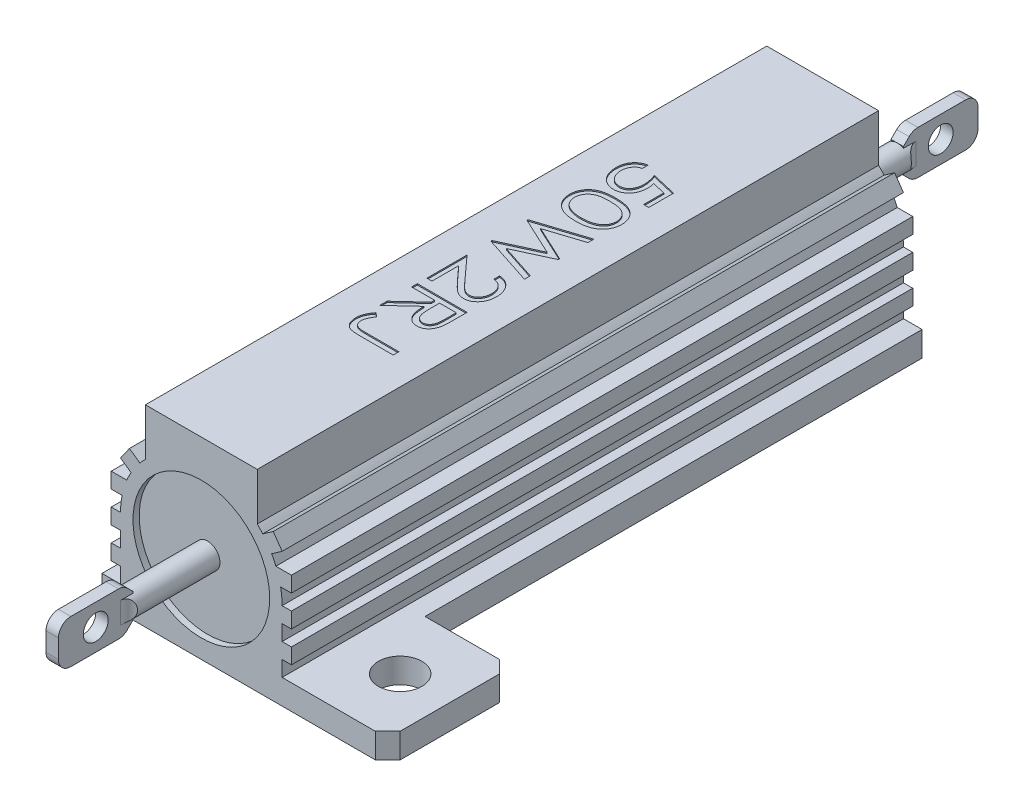
from build123d import *
from build123d.topology import SkipClean

# Parameters (mm, degrees)
BOSS_EXTRUDE1_DEPTH = 25
SKETCH3_W           = 7
SKETCH3_H           = 10
SKETCH3_R           = 1.75
BOSS_EXTRUDE5_DEPTH = 2
CHAMFER1_SIZE       = 1
BOSS_EXTRUDE2_DEPTH = 24.5
BOSS_EXTRUDE3_DEPTH = 31
SKETCH2_R           = 1
BOSS_EXTRUDE4_DEPTH = 0.5
FILLET1_R           = 1
CUT_EXTRUDE1_DEPTH  = 0.1


with BuildPart() as part:
    # Sketch1 → Boss-Extrude1 (new, symmetric)
    with BuildSketch(Plane.XY):
        with BuildLine():
            Line((-8, -7), (-6.5, -7))
            Line((-6.5, -7), (6.5, -7))
            Line((6.5, -7), (8, -7))
            Line((8, -7), (8, -5))
            Line((8, -5), (6.5, -5))
            Line((6.5, -5), (6.5, -3.75))
            Line((6.5, -3.75), (7.25, -3.75))
            Line((7.25, -3.75), (7.25, -2.5))
            Line((7.25, -2.5), (6.5, -2.5))
            Line((6.5, -2.5), (6.5, -1.25))
            Line((6.5, -1.25), (7.25, -1.25))
            Line((7.25, -1.25), (7.25, 0))
            Line((7.25, 0), (6.5, 0))
            ThreePointArc((6.5, 0), (6.469597753, 0.62793703), (6.378675411, 1.25))
            Line((6.378675411, 1.25), (7.25, 1.25))
            Line((7.25, 1.25), (7.25, 2.5))
            Line((7.25, 2.5), (6, 2.5))
            ThreePointArc((6, 2.5), (5.839619421, 2.854618191), (5.65830246, 3.199001918))
            Line((5.65830246, 3.199001918), (6.502125605, 3.789853245))
            Line((6.502125605, 3.789853245), (5.785155059, 4.8137933))
            Line((5.785155059, 4.8137933), (4.941331915, 4.222941973))
            ThreePointArc((4.941331915, 4.222941973), (4.726448986, 4.462138499), (4.5, 4.69041576))
            Line((4.5, 4.69041576), (4.5, 3.16227766))
            ThreePointArc((4.5, 3.16227766), (5.244044241, 1.658312395), (5.5, 0))
            ThreePointArc((5.5, 0), (-1.658312395, -5.244044241), (-4.5, 3.16227766))
            Line((-4.5, 3.16227766), (-4.5, 4.69041576))
            ThreePointArc((-4.5, 4.69041576), (-4.726448986, 4.462138499), (-4.941331915, 4.222941973))
            Line((-4.941331915, 4.222941973), (-5.785155059, 4.8137933))
            Line((-5.785155059, 4.8137933), (-6.502125605, 3.789853245))
            Line((-6.502125605, 3.789853245), (-5.65830246, 3.199001918))
            ThreePointArc((-5.65830246, 3.199001918), (-5.839619421, 2.854618191), (-6, 2.5))
            Line((-6, 2.5), (-7.25, 2.5))
            Line((-7.25, 2.5), (-7.25, 1.25))
            Line((-7.25, 1.25), (-6.378675411, 1.25))
            ThreePointArc((-6.378675411, 1.25), (-6.469597753, 0.62793703), (-6.5, 0))
            Line((-6.5, 0), (-7.25, 0))
            Line((-7.25, 0), (-7.25, -1.25))
            Line((-7.25, -1.25), (-6.5, -1.25))
            Line((-6.5, -1.25), (-6.5, -2.5))
            Line((-6.5, -2.5), (-7.25, -2.5))
            Line((-7.25, -2.5), (-7.25, -3.75))
            Line((-7.25, -3.75), (-6.5, -3.75))
            Line((-6.5, -3.75), (-6.5, -5))
            Line((-6.5, -5), (-8, -5))
            Line((-8, -5), (-8, -7))
        make_face()
        with BuildLine():
            ThreePointArc((4.5, 4.69041576), (0, 6.5), (-4.5, 4.69041576))
            Line((-4.5, 4.69041576), (-4.5, 3.16227766))
            ThreePointArc((-4.5, 3.16227766), (0, 5.5), (4.5, 3.16227766))
            Line((4.5, 3.16227766), (4.5, 4.69041576))
        make_face()
        with BuildLine():
            Line((-4.5, 8.5), (-4.5, 4.69041576))
            ThreePointArc((-4.5, 4.69041576), (0, 6.5), (4.5, 4.69041576))
            Line((4.5, 4.69041576), (4.5, 8.5))
            Line((4.5, 8.5), (-4.5, 8.5))
        make_face()
    extrude(amount=BOSS_EXTRUDE1_DEPTH, both=True)

    # Sketch3 → Boss-Extrude5 (add)
    # profile 1 of 2: a face of its own
    with BuildSketch(Plane.XZ.offset(7)):
        with Locations((11.5, 20)):
            Rectangle(SKETCH3_W, SKETCH3_H)
        with Locations((11, 20)):
            Circle(SKETCH3_R, mode=Mode.SUBTRACT)
    # profile 2 of 2: a face of its own
    with BuildSketch(Plane.XZ.offset(7)):
        with Locations((-11.5, -20)):
            Rectangle(SKETCH3_W, SKETCH3_H)
        with Locations((-11, -20)):
            Circle(SKETCH3_R, mode=Mode.SUBTRACT)
    extrude(amount=-BOSS_EXTRUDE5_DEPTH)

    # Chamfer1
    chamfer1_edges = [part.edges().sort_by_distance(p)[0] for p in [
        (15, -6, 25),
        (15, -6, 15),
        (-15, -6, -25),
        (-15, -6, -15),
    ]]
    chamfer(chamfer1_edges, length=CHAMFER1_SIZE)

    # Sketch4 → Cut-Extrude1 (cut)
    # profile 1 of 6: a face of its own
    with BuildSketch(Plane(origin=(0, 8.5, 0), x_dir=(1, 0, 0), z_dir=(0, 1, 0))):
        with BuildLine():
            Line((2, 9), (1.58974359, 9))
            Line((1.58974359, 9), (1.58974359, 10.623397436))
            Line((1.58974359, 10.623397436), (0.532852564, 10.867788462))
            add(Edge.make_bspline(
                [(0.532852564, 10.867788462), (0.545515776, 10.81824875), (0.570016319, 10.722400257), (0.595129408, 10.580728118), (0.612791333, 10.446761137), (0.614538174, 10.359560985), (0.615384615, 10.317307692)],
                knots=[0, 0, 0, 0, 1.098923107, 2.126175579, 3.092028514, 4, 4, 4, 4], degree=3))
            add(Edge.make_bspline(
                [(0.615384615, 10.317307692), (0.614420833, 10.265170431), (0.612527032, 10.162722458), (0.594273232, 10.01267072), (0.565747419, 9.869473083), (0.525595249, 9.733468535), (0.474196448, 9.604243292), (0.410621807, 9.482247605), (0.335824672, 9.366872644), (0.249722975, 9.260153573), (0.1545364, 9.16380246), (0.053572076, 9.077619795), (-0.055118695, 9.006245124), (-0.170276956, 8.947977256), (-0.2916679, 8.902153844), (-0.419764378, 8.869202991), (-0.55441913, 8.849706339), (-0.646303066, 8.847352764), (-0.693108974, 8.846153846)],
                knots=[0, 0, 0, 0, 1.134306129, 2.228873559, 3.284575577, 4.309103366, 5.310866403, 6.306691536, 7.298316829, 8.298797156, 9.285365892, 10.242552919, 11.182533008, 12.108057413, 13.046310257, 14.000845743, 14.981625785, 16, 16, 16, 16], degree=3))
            add(Edge.make_bspline(
                [(-0.693108974, 8.846153846), (-0.725724228, 8.846693175), (-0.79059043, 8.847765808), (-0.886691495, 8.858715416), (-0.980933942, 8.875477791), (-1.073045693, 8.898754757), (-1.16324176, 8.928217259), (-1.250786459, 8.965642039), (-1.336941637, 9.00885615), (-1.420403424, 9.059098671), (-1.500407698, 9.115110516), (-1.575985703, 9.176082872), (-1.646341157, 9.241992976), (-1.712809031, 9.311862544), (-1.773211814, 9.387360884), (-1.829994679, 9.467002825), (-1.880851662, 9.551945408), (-1.927325232, 9.641065031), (-1.969436936, 9.733845117), (-2.004226251, 9.83140196), (-2.034867896, 9.932123614), (-2.059595738, 10.036507322), (-2.078922283, 10.144042984), (-2.092120524, 10.255096344), (-2.101691768, 10.369758403), (-2.102270276, 10.447628742), (-2.102564103, 10.487179487)],
                knots=[0, 0, 0, 0, 0.969887702, 1.928941986, 2.873436412, 3.815789427, 4.753003305, 5.693042149, 6.645358263, 7.618300532, 8.588188234, 9.548656786, 10.504380954, 11.45430748, 12.414776032, 13.378165196, 14.362012553, 15.357121383, 16.367185624, 17.390198941, 18.435887273, 19.497781362, 20.57943811, 21.684223554, 22.823805247, 24, 24, 24, 24], degree=3))
            add(Edge.make_bspline(
                [(-2.102564103, 10.487179487), (-2.10177636, 10.533971364), (-2.10022801, 10.62594326), (-2.084005173, 10.760816417), (-2.060787507, 10.890477431), (-2.025897143, 11.014206383), (-1.981878402, 11.132907213), (-1.927188163, 11.245545106), (-1.863755968, 11.353225641), (-1.789882448, 11.453591916), (-1.709000315, 11.546954805), (-1.621038468, 11.630623771), (-1.527956704, 11.705182877), (-1.428071715, 11.768138856), (-1.323203052, 11.822637556), (-1.212207665, 11.866342548), (-1.095740075, 11.901656286), (-1.015143188, 11.91587956), (-0.974358974, 11.923076923)],
                knots=[0, 0, 0, 0, 1.123367549, 2.208038014, 3.258707693, 4.284481523, 5.291404347, 6.295687251, 7.288117666, 8.289013781, 9.284818446, 10.25134312, 11.201179919, 12.144429081, 13.082690711, 14.035750275, 15.006036297, 16, 16, 16, 16], degree=3))
            Line((-0.974358974, 11.923076923), (-0.974358974, 11.461538462))
            add(Edge.make_bspline(
                [(-0.974358974, 11.461538462), (-1.012616836, 11.451866417), (-1.086562385, 11.4331721), (-1.189009172, 11.389369079), (-1.281732796, 11.338724226), (-1.362645945, 11.275857021), (-1.434398904, 11.203242975), (-1.497741759, 11.11964673), (-1.555038822, 11.025685527), (-1.602651632, 10.921243055), (-1.643123962, 10.811134478), (-1.670595582, 10.69625493), (-1.689402155, 10.579145036), (-1.691335887, 10.499807362), (-1.692307692, 10.459935897)],
                knots=[0, 0, 0, 0, 1.060576442, 2.049903014, 2.989775767, 3.897109116, 4.796892185, 5.730087544, 6.713966125, 7.752830045, 8.814794405, 9.866194127, 10.92764736, 12, 12, 12, 12], degree=3))
            add(Edge.make_bspline(
                [(-1.692307692, 10.459935897), (-1.691364481, 10.42116312), (-1.689504679, 10.344711817), (-1.675352861, 10.232187956), (-1.653587975, 10.123611295), (-1.620469294, 10.019780508), (-1.581375769, 9.918930231), (-1.530031324, 9.823833102), (-1.471152432, 9.732208787), (-1.403888297, 9.646072318), (-1.32991369, 9.566851862), (-1.250214198, 9.497500498), (-1.166030903, 9.438572815), (-1.076752004, 9.391076491), (-0.983781206, 9.352981429), (-0.885845253, 9.326405626), (-0.783331339, 9.311195932), (-0.713458276, 9.308874296), (-0.677884615, 9.307692308)],
                knots=[0, 0, 0, 0, 1.088617922, 2.146512666, 3.18073907, 4.193857714, 5.203749857, 6.213781285, 7.222920953, 8.259782748, 9.278688868, 10.262388098, 11.221673824, 12.158013981, 13.096874736, 14.037681318, 15.0009475, 16, 16, 16, 16], degree=3))
            add(Edge.make_bspline(
                [(-0.677884615, 9.307692308), (-0.645776502, 9.308573356), (-0.582826322, 9.310300712), (-0.490889303, 9.325129203), (-0.403713261, 9.349070244), (-0.321167461, 9.383117242), (-0.243365846, 9.426655298), (-0.169492816, 9.479020725), (-0.101335445, 9.542158243), (-0.038331904, 9.61438622), (0.019295755, 9.694043508), (0.069011826, 9.780906051), (0.110683919, 9.874245344), (0.146443757, 9.97334394), (0.172205632, 10.079856241), (0.191582166, 10.191984956), (0.202764654, 10.310672005), (0.204325937, 10.391803837), (0.205128205, 10.43349359)],
                knots=[0, 0, 0, 0, 0.959607918, 1.881377768, 2.776607197, 3.65761547, 4.544289218, 5.437449904, 6.358839065, 7.315284292, 8.299439248, 9.294038853, 10.302048393, 11.352906328, 12.439604126, 13.574060817, 14.753426351, 16, 16, 16, 16], degree=3))
            add(Edge.make_bspline(
                [(0.205128205, 10.43349359), (0.204476532, 10.46983782), (0.203137533, 10.54451468), (0.192939112, 10.659234783), (0.176874851, 10.779538037), (0.15422388, 10.905417362), (0.125396906, 11.036666872), (0.089680806, 11.173381196), (0.0482573, 11.315890896), (0.016339103, 11.412224667), (0, 11.461538462)],
                knots=[0, 0, 0, 0, 0.828490731, 1.702308341, 2.623773087, 3.594863751, 4.617271015, 5.686547465, 6.815730754, 8, 8, 8, 8], degree=3))
            Line((0, 11.461538462), (2, 11))
            Line((2, 11), (2, 9))
        make_face()
    # profile 2 of 6: a face of its own
    with BuildSketch(Plane(origin=(0, 8.5, 0), x_dir=(1, 0, 0), z_dir=(0, 1, 0))):
        with BuildLine():
            add(Edge.make_bspline(
                [(-0.001602564, 8.333333333), (0.06251601, 8.332789412), (0.187089565, 8.331732647), (0.368521938, 8.321528977), (0.538971244, 8.307365626), (0.697953809, 8.28443674), (0.845758006, 8.2569777), (0.982302666, 8.222625826), (1.107772825, 8.182068749), (1.222488955, 8.134383286), (1.328042887, 8.080782463), (1.427076663, 8.023531002), (1.518840784, 7.959517086), (1.604572209, 7.891052971), (1.683272472, 7.816802878), (1.756062286, 7.738385441), (1.820670869, 7.653465747), (1.880250573, 7.565005657), (1.932042817, 7.471673557), (1.977863028, 7.375721784), (2.016448684, 7.276901495), (2.047662374, 7.175323605), (2.07267235, 7.071269482), (2.09014998, 6.964420598), (2.100962796, 6.854926878), (2.102025931, 6.781008224), (2.102564103, 6.743589744)],
                knots=[0, 0, 0, 0, 1.542683654, 2.997221792, 4.371598944, 5.656797318, 6.860561199, 7.987553175, 9.042377021, 10.030645594, 10.973394823, 11.889388256, 12.780791065, 13.663064894, 14.526958713, 15.382106205, 16.234399085, 17.091789701, 17.946381534, 18.800199673, 19.648776936, 20.49647757, 21.355408439, 22.221808829, 23.099858982, 24, 24, 24, 24], degree=3))
            add(Edge.make_bspline(
                [(2.102564103, 6.743589744), (2.102025692, 6.705637427), (2.100961929, 6.63065327), (2.090148894, 6.519561068), (2.072674729, 6.411112669), (2.047657949, 6.3054623), (2.016472527, 6.202272908), (1.977808464, 6.101900055), (1.932245014, 6.004049559), (1.879216391, 5.909687615), (1.819919768, 5.818427097), (1.752721936, 5.732284396), (1.678526787, 5.651134053), (1.598111283, 5.57426875), (1.509722035, 5.503423963), (1.414878916, 5.436513344), (1.312765413, 5.374876326), (1.203491065, 5.317775613), (1.086043141, 5.265970476), (0.958952145, 5.222111136), (0.822283535, 5.185544786), (0.676187356, 5.155300362), (0.520309893, 5.131083364), (0.354701788, 5.114991242), (0.179635059, 5.104028066), (0.059847118, 5.103060468), (-0.001602564, 5.102564103)],
                knots=[0, 0, 0, 0, 0.905226779, 1.788498657, 2.660108446, 3.524138063, 4.376813936, 5.230061085, 6.088148717, 6.949707488, 7.810441066, 8.682307051, 9.552891307, 10.431831136, 11.333484681, 12.252799274, 13.19921049, 14.17683564, 15.192654415, 16.258736151, 17.380986388, 18.565756088, 19.816677794, 21.14251623, 22.534147352, 24, 24, 24, 24], degree=3))
            add(Edge.make_bspline(
                [(-0.001602564, 5.102564103), (-0.062784547, 5.103065863), (-0.182037556, 5.104043872), (-0.356313237, 5.114929037), (-0.521047907, 5.131288021), (-0.676147942, 5.154552545), (-0.821616313, 5.183662183), (-0.95740195, 5.220916011), (-1.084231393, 5.263327595), (-1.201063042, 5.314604442), (-1.309547196, 5.370869181), (-1.411199933, 5.431866863), (-1.505755245, 5.498581103), (-1.594076608, 5.569766662), (-1.675602628, 5.646053776), (-1.749243399, 5.728273925), (-1.816869268, 5.814741836), (-1.876970427, 5.906240145), (-1.929623939, 6.001892392), (-1.976284546, 6.099872843), (-2.014764304, 6.201060902), (-2.046941609, 6.304278279), (-2.071995892, 6.410571262), (-2.089005528, 6.519355612), (-2.101248131, 6.630599162), (-2.102121972, 6.705627987), (-2.102564103, 6.743589744)],
                knots=[0, 0, 0, 0, 1.460743023, 2.84721075, 4.167850277, 5.412587228, 6.590844802, 7.707910044, 8.772833715, 9.781134206, 10.751002957, 11.689474493, 12.609583831, 13.512016852, 14.396351346, 15.272413723, 16.145033432, 17.015342675, 17.883218137, 18.750530986, 19.604515764, 20.465899004, 21.330675571, 22.209334244, 23.093990656, 24, 24, 24, 24], degree=3))
            add(Edge.make_bspline(
                [(-2.102564103, 6.743589744), (-2.102022963, 6.781007683), (-2.100953965, 6.854925266), (-2.090184105, 6.964426825), (-2.072598993, 7.070929408), (-2.04829964, 7.174708247), (-2.018438234, 7.276056825), (-1.979238739, 7.373911409), (-1.93452956, 7.469291544), (-1.883427019, 7.56177066), (-1.824533093, 7.649817798), (-1.759969592, 7.734276692), (-1.687587677, 7.813155042), (-1.607514912, 7.885608905), (-1.522806105, 7.955349548), (-1.429971063, 8.018538525), (-1.330509243, 8.076843634), (-1.224097407, 8.131176266), (-1.10858473, 8.179610955), (-0.982456034, 8.221294078), (-0.845077561, 8.254943864), (-0.697532539, 8.283954326), (-0.538907217, 8.306214764), (-0.369382326, 8.321864099), (-0.188950241, 8.33162685), (-0.065183789, 8.332754194), (-0.001602564, 8.333333333)],
                knots=[0, 0, 0, 0, 0.901313614, 1.780507586, 2.648036619, 3.500347198, 4.347271604, 5.190962528, 6.037324413, 6.884273269, 7.733858471, 8.587261616, 9.443523092, 10.308877354, 11.187293768, 12.085154678, 13.011148997, 13.963773228, 14.961747202, 16.026069565, 17.160769593, 18.367320705, 19.647821669, 21.018168876, 22.468175576, 24, 24, 24, 24], degree=3))
        make_face()
        with BuildLine():
            add(Edge.make_bspline(
                [(0, 7.871794872), (-0.053424022, 7.871280344), (-0.157106416, 7.870281778), (-0.307859368, 7.864115192), (-0.448420859, 7.852873236), (-0.578949196, 7.837984738), (-0.699348417, 7.818144395), (-0.809811537, 7.793416133), (-0.910270116, 7.764840456), (-1.001393714, 7.731760447), (-1.084411094, 7.693661598), (-1.161729501, 7.651825967), (-1.233940124, 7.606311802), (-1.301049949, 7.55635306), (-1.362671531, 7.501663171), (-1.419779757, 7.443289993), (-1.471496168, 7.380254766), (-1.532099612, 7.291642542), (-1.596661344, 7.176259264), (-1.651081099, 7.030859934), (-1.685854705, 6.881437319), (-1.690149134, 6.78010201), (-1.692307692, 6.729166667)],
                knots=[0, 0, 0, 0, 1.388587631, 2.694894295, 3.920573386, 5.05291137, 6.108598713, 7.090490714, 7.993531689, 8.82151309, 9.607480571, 10.365416635, 11.104976342, 11.824185169, 12.537337675, 13.244279737, 13.944715534, 14.653359842, 16.032946572, 17.368730189, 18.677414287, 20, 20, 20, 20], degree=3))
            add(Edge.make_bspline(
                [(-1.692307692, 6.729166667), (-1.690524086, 6.677951008), (-1.686984163, 6.576303354), (-1.651750866, 6.427424759), (-1.599145666, 6.282940414), (-1.536163762, 6.168897504), (-1.47629641, 6.082066083), (-1.425085367, 6.020404337), (-1.368566602, 5.962970894), (-1.306076117, 5.910154409), (-1.239727397, 5.859620678), (-1.166396232, 5.815486401), (-1.08850997, 5.773976225), (-1.033581169, 5.750657159), (-1.005608974, 5.738782051)],
                knots=[0, 0, 0, 0, 1.435202654, 2.84844493, 4.271653763, 5.741104123, 6.489771913, 7.229832304, 7.987899838, 8.748188279, 9.524858768, 10.325895147, 11.147471145, 12, 12, 12, 12], degree=3))
            add(Edge.make_bspline(
                [(-1.005608974, 5.738782051), (-0.969985247, 5.724691486), (-0.89789939, 5.696178735), (-0.784966465, 5.661516441), (-0.667525691, 5.630567624), (-0.5442493, 5.607156933), (-0.416008133, 5.58753606), (-0.281983718, 5.574538474), (-0.142766542, 5.564969997), (-0.04809445, 5.56439478), (0, 5.564102564)],
                knots=[0, 0, 0, 0, 0.89477914, 1.810616812, 2.758161515, 3.731176502, 4.7408655, 5.788454827, 6.876511068, 8, 8, 8, 8], degree=3))
            add(Edge.make_bspline(
                [(0, 5.564102564), (0.048087242, 5.564537191), (0.142180988, 5.56538764), (0.279824719, 5.57280183), (0.41090857, 5.584302816), (0.535101894, 5.60238879), (0.652867463, 5.623569229), (0.764062787, 5.649758718), (0.86813572, 5.682210441), (0.966351124, 5.717849029), (1.057378031, 5.758836457), (1.142293867, 5.803100246), (1.220921163, 5.851026302), (1.293359248, 5.903151481), (1.359060691, 5.959393187), (1.418920617, 6.018808765), (1.471822685, 6.082264572), (1.533331525, 6.170553792), (1.595680111, 6.286211532), (1.652627214, 6.429703711), (1.685422657, 6.578391693), (1.690007801, 6.67880148), (1.692307692, 6.729166667)],
                knots=[0, 0, 0, 0, 1.249780456, 2.445482825, 3.581852642, 4.668687876, 5.706271375, 6.691314309, 7.63556384, 8.538297997, 9.405302693, 10.228187559, 11.02591342, 11.796629424, 12.545106863, 13.271626958, 13.986275284, 14.689228451, 16.065495506, 17.390812878, 18.691241169, 20, 20, 20, 20], degree=3))
            add(Edge.make_bspline(
                [(1.692307692, 6.729166667), (1.690025216, 6.780335438), (1.685486931, 6.882075169), (1.652679074, 7.032327461), (1.596227565, 7.176693848), (1.532789251, 7.291513629), (1.473179351, 7.379740208), (1.421037584, 7.441652383), (1.364622786, 7.500185725), (1.302093585, 7.55379911), (1.23586617, 7.604865218), (1.163274583, 7.650141482), (1.086051044, 7.692139774), (1.002816753, 7.729944037), (0.912071301, 7.76431504), (0.811618056, 7.79238289), (0.701277169, 7.817637397), (0.580474889, 7.836881377), (0.449819179, 7.853097061), (0.308921073, 7.864095109), (0.15790953, 7.870292419), (0.053691811, 7.871284013), (0, 7.871794872)],
                knots=[0, 0, 0, 0, 1.329473786, 2.643415121, 3.97515249, 5.345273436, 6.044244214, 6.739308648, 7.44623188, 8.154789303, 8.878154807, 9.617694816, 10.37561069, 11.161557236, 11.991928558, 12.894945479, 13.870039332, 14.932546687, 16.072574108, 17.291300563, 18.604508161, 20, 20, 20, 20], degree=3))
        make_face(mode=Mode.SUBTRACT)
    # profile 3 of 6: a face of its own
    with BuildSketch(Plane(origin=(0, 8.5, 0), x_dir=(1, 0, 0), z_dir=(0, 1, 0))):
        Polygon((2, 4.58974359), (2, 4.110576923), (-0.871794872, 3.179487179), (2, 1.838942308), (2, 1.737179487), (-0.871794872, 0.41025641), (2, -0.525641026), (2, -1), (-2, 0.303685897), (-2, 0.396634615), (1.025641026, 1.794871795), (-2, 3.207532051), (-2, 3.292467949), align=None)
    # profile 4 of 6: a face of its own
    with BuildSketch(Plane(origin=(0, 8.5, 0), x_dir=(1, 0, 0), z_dir=(0, 1, 0))):
        with BuildLine():
            Line((0.769230769, -2.230769231), (0.769230769, -1.769230769))
            add(Edge.make_bspline(
                [(0.769230769, -1.769230769), (0.816876526, -1.771964035), (0.910634632, -1.7773426), (1.047455059, -1.802568524), (1.177448513, -1.841628166), (1.30179788, -1.892261806), (1.418107785, -1.959518216), (1.529959001, -2.036794479), (1.633138534, -2.130185272), (1.729821135, -2.234678377), (1.816967213, -2.349164586), (1.894076891, -2.470840859), (1.957922643, -2.59974868), (2.011458971, -2.734921675), (2.051761814, -2.877071171), (2.081723565, -3.025411938), (2.099626583, -3.18038089), (2.101573649, -3.286010701), (2.102564103, -3.33974359)],
                knots=[0, 0, 0, 0, 0.999305455, 1.966449753, 2.906727325, 3.840100279, 4.772415491, 5.71648318, 6.683708445, 7.681790664, 8.695968757, 9.694427516, 10.695611955, 11.705828884, 12.736763285, 13.787187205, 14.874362987, 16, 16, 16, 16], degree=3))
            add(Edge.make_bspline(
                [(2.102564103, -3.33974359), (2.101519222, -3.392671492), (2.099471444, -3.496400652), (2.082523164, -3.647860481), (2.054239768, -3.79139616), (2.016216219, -3.927690821), (1.965584843, -4.056230472), (1.903507332, -4.17677802), (1.831379403, -4.290175986), (1.747024232, -4.393189685), (1.656689852, -4.487311042), (1.561010207, -4.569606653), (1.461246786, -4.63913389), (1.357126412, -4.695585276), (1.249132714, -4.739898331), (1.137264364, -4.772471615), (1.020919623, -4.79102026), (0.942104075, -4.793578155), (0.90224359, -4.794871795)],
                knots=[0, 0, 0, 0, 1.208765672, 2.368963135, 3.475747546, 4.54760944, 5.596726645, 6.625421298, 7.640840976, 8.660376309, 9.661397379, 10.617631144, 11.538305991, 12.433750383, 13.317478723, 14.199942547, 15.089631881, 16, 16, 16, 16], degree=3))
            add(Edge.make_bspline(
                [(0.90224359, -4.794871795), (0.874179866, -4.794178614), (0.818184905, -4.792795526), (0.73481578, -4.784029248), (0.652723811, -4.768415105), (0.571692811, -4.747877845), (0.492112039, -4.720513614), (0.414194726, -4.686421842), (0.337337713, -4.647211669), (0.260043817, -4.601585238), (0.181622122, -4.545242749), (0.096256143, -4.480579277), (0.005080335, -4.40324488), (-0.092082071, -4.31411245), (-0.196797667, -4.214721808), (-0.306924236, -4.102841404), (-0.424842893, -3.980595955), (-0.504451227, -3.894131158), (-0.545673077, -3.849358974)],
                knots=[0, 0, 0, 0, 0.755037436, 1.506510444, 2.252051041, 3.001459937, 3.753619725, 4.513157152, 5.287639056, 6.073865477, 6.925081015, 7.88368158, 8.954604251, 10.13979607, 11.43073035, 12.838176805, 14.362781941, 16, 16, 16, 16], degree=3))
            Line((-0.545673077, -3.849358974), (-1.58974359, -2.697916667))
            Line((-1.58974359, -2.697916667), (-1.58974359, -4.846153846))
            Line((-1.58974359, -4.846153846), (-2, -4.846153846))
            Line((-2, -4.846153846), (-2, -1.615384615))
            Line((-2, -1.615384615), (-0.344551282, -3.442307692))
            add(Edge.make_bspline(
                [(-0.344551282, -3.442307692), (-0.305116604, -3.486729579), (-0.229409798, -3.572010842), (-0.11920392, -3.693113224), (-0.016042842, -3.801271294), (0.077746014, -3.898758825), (0.165349022, -3.982400374), (0.243717963, -4.055351094), (0.314930277, -4.115407003), (0.397724292, -4.179162312), (0.499129053, -4.240571557), (0.623114393, -4.294435602), (0.751242653, -4.327387999), (0.837954269, -4.331348505), (0.881410256, -4.333333333)],
                knots=[0, 0, 0, 0, 1.369096229, 2.628394782, 3.773647796, 4.814104547, 5.745816241, 6.564926978, 7.281420806, 7.892118857, 8.972179848, 10.00361896, 10.999503016, 12, 12, 12, 12], degree=3))
            add(Edge.make_bspline(
                [(0.881410256, -4.333333333), (0.908706279, -4.33235985), (0.962573623, -4.330438728), (1.04180914, -4.316644801), (1.117751385, -4.292928477), (1.191327056, -4.260751713), (1.26175555, -4.218976471), (1.329041441, -4.167688131), (1.392936176, -4.107083897), (1.454436072, -4.038961955), (1.509459114, -3.963331951), (1.559278455, -3.883758597), (1.599856668, -3.799124575), (1.633623298, -3.710686846), (1.660330993, -3.618282226), (1.678441673, -3.521402181), (1.689905594, -3.420680834), (1.691500122, -3.352061102), (1.692307692, -3.317307692)],
                knots=[0, 0, 0, 0, 0.909049155, 1.79396327, 2.669163632, 3.553540893, 4.462938275, 5.390007228, 6.365624904, 7.392625574, 8.442493626, 9.477058154, 10.515593567, 11.563159563, 12.627590833, 13.714648234, 14.842552086, 16, 16, 16, 16], degree=3))
            add(Edge.make_bspline(
                [(1.692307692, -3.317307692), (1.691477167, -3.280691332), (1.689842475, -3.208620704), (1.678799842, -3.102972121), (1.659230368, -3.002061445), (1.63314366, -2.905989201), (1.599150074, -2.814522944), (1.557814554, -2.727829787), (1.507299442, -2.646536361), (1.45088758, -2.569814059), (1.387724401, -2.499036785), (1.317595594, -2.436140168), (1.24112736, -2.381595968), (1.158782432, -2.334688682), (1.070096303, -2.296147733), (0.975281992, -2.265961651), (0.874488111, -2.243059945), (0.804857619, -2.234929315), (0.769230769, -2.230769231)],
                knots=[0, 0, 0, 0, 1.110349156, 2.185459171, 3.216369442, 4.224372026, 5.200771625, 6.171612639, 7.131479122, 8.098562748, 9.056376771, 10.002753386, 10.948991359, 11.899345309, 12.871401816, 13.875459424, 14.912966371, 16, 16, 16, 16], degree=3))
        make_face()
    # profile 5 of 6: a face of its own
    with BuildSketch(Plane(origin=(0, 8.5, 0), x_dir=(1, 0, 0), z_dir=(0, 1, 0))):
        with BuildLine():
            Line((2, -5.615384615), (2, -6.5625))
            add(Edge.make_bspline(
                [(2, -6.5625), (1.999822839, -6.625800983), (1.999482707, -6.747333182), (1.997569986, -6.921511321), (1.992141315, -7.079606108), (1.987407445, -7.221781679), (1.978828206, -7.348075924), (1.970817257, -7.458525113), (1.959820298, -7.552910882), (1.950002593, -7.610075693), (1.945512821, -7.636217949)],
                knots=[0, 0, 0, 0, 1.411631718, 2.710206034, 3.884121323, 4.939192662, 5.882155086, 6.70671764, 7.408564139, 8, 8, 8, 8], degree=3))
            add(Edge.make_bspline(
                [(1.945512821, -7.636217949), (1.938285358, -7.670799882), (1.924036784, -7.738976406), (1.894087503, -7.837419688), (1.858508674, -7.930997443), (1.818180912, -8.020109015), (1.770404794, -8.103659582), (1.717432425, -8.182435188), (1.658819679, -8.256706419), (1.594044329, -8.324833293), (1.525728952, -8.388117658), (1.451460735, -8.441394433), (1.374385012, -8.487858694), (1.292745197, -8.524669955), (1.20765082, -8.55356658), (1.118590943, -8.574453495), (1.025774276, -8.587709966), (0.962384827, -8.589060012), (0.930288462, -8.58974359)],
                knots=[0, 0, 0, 0, 1.11641643, 2.200958269, 3.248516537, 4.279957034, 5.289565817, 6.287204707, 7.27885839, 8.276390078, 9.256727559, 10.217710867, 11.160418021, 12.097511966, 13.042749274, 13.99714418, 14.985881811, 16, 16, 16, 16], degree=3))
            add(Edge.make_bspline(
                [(0.930288462, -8.58974359), (0.903295014, -8.589002), (0.849994522, -8.587537678), (0.771167004, -8.579689878), (0.694928006, -8.56550568), (0.621609685, -8.543890507), (0.550307572, -8.518832782), (0.481441216, -8.487087581), (0.415241841, -8.449574449), (0.35164288, -8.406223425), (0.291979366, -8.357030211), (0.234381974, -8.304322492), (0.181714205, -8.245510057), (0.132655605, -8.182070241), (0.087600192, -8.113377031), (0.046247018, -8.039967982), (0.008214449, -7.961686864), (-0.025557886, -7.877905167), (-0.055056237, -7.787327289), (-0.08201341, -7.689386543), (-0.102657472, -7.582879183), (-0.12154405, -7.468596243), (-0.135614781, -7.346109186), (-0.145911998, -7.215419311), (-0.152385582, -7.07672021), (-0.153350412, -6.981577662), (-0.153846154, -6.932692308)],
                knots=[0, 0, 0, 0, 0.870425765, 1.71871789, 2.551348976, 3.36633719, 4.180779287, 4.986110956, 5.807488844, 6.631525723, 7.464023206, 8.298789019, 9.146250278, 10.005745189, 10.882283451, 11.792317713, 12.720505239, 13.686356746, 14.702091783, 15.790428515, 16.959096846, 18.197841434, 19.524460885, 20.932564134, 22.423915564, 24, 24, 24, 24], degree=3))
            Line((-0.153846154, -6.932692308), (-2, -8.641025641))
            Line((-2, -8.641025641), (-2, -8.056089744))
            Line((-2, -8.056089744), (-0.153846154, -6.34775641))
            Line((-0.153846154, -6.34775641), (-0.153846154, -6.076923077))
            Line((-0.153846154, -6.076923077), (-2, -6.076923077))
            Line((-2, -6.076923077), (-2, -5.615384615))
            Line((-2, -5.615384615), (2, -5.615384615))
        make_face()
        with BuildLine():
            Line((1.58974359, -6.076923077), (0.256410256, -6.076923077))
            Line((0.256410256, -6.076923077), (0.250801282, -6.914262821))
            add(Edge.make_bspline(
                [(0.250801282, -6.914262821), (0.250782522, -6.953531228), (0.250746268, -7.029420241), (0.255330585, -7.139195103), (0.260487315, -7.24102138), (0.268438347, -7.334833726), (0.278807231, -7.420901501), (0.291272612, -7.499041431), (0.306543806, -7.569390307), (0.329261823, -7.651125219), (0.365772273, -7.742487023), (0.418640581, -7.841811013), (0.485797785, -7.926617712), (0.561450911, -7.999462365), (0.646556248, -8.056023764), (0.736918509, -8.0979057), (0.832432955, -8.123859312), (0.898079161, -8.126751017), (0.931089744, -8.128205128)],
                knots=[0, 0, 0, 0, 1.205210125, 2.329154969, 3.37194724, 4.334671185, 5.218363492, 6.032456165, 6.762538737, 7.426972909, 8.634272633, 9.775399229, 10.867649931, 11.940528767, 12.986506815, 13.988002093, 14.988254966, 16, 16, 16, 16], degree=3))
            add(Edge.make_bspline(
                [(0.931089744, -8.128205128), (0.963303616, -8.12674794), (1.027380653, -8.123849429), (1.120862873, -8.097818503), (1.209278498, -8.055423068), (1.291544965, -7.997183981), (1.366586736, -7.926647496), (1.430163666, -7.843739419), (1.483116076, -7.751291793), (1.516484823, -7.665180103), (1.537245686, -7.588025023), (1.55166291, -7.520665434), (1.563483368, -7.444411108), (1.57270611, -7.3593518), (1.580899965, -7.265601946), (1.586288311, -7.162714593), (1.58950083, -7.051036358), (1.589660841, -6.973560069), (1.58974359, -6.93349359)],
                knots=[0, 0, 0, 0, 1.007032202, 2.003100998, 3.013080533, 4.064053814, 5.146627563, 6.225577408, 7.323037005, 8.472265414, 9.105258211, 9.823693304, 10.628015815, 11.520150631, 12.502182865, 13.574239637, 14.745530037, 16, 16, 16, 16], degree=3))
            Line((1.58974359, -6.93349359), (1.58974359, -6.076923077))
        make_face(mode=Mode.SUBTRACT)
    # profile 6 of 6: a face of its own
    with BuildSketch(Plane(origin=(0, 8.5, 0), x_dir=(1, 0, 0), z_dir=(0, 1, 0))):
        with BuildLine():
            Line((2, -11.102564103), (2, -11.564102564))
            Line((2, -11.564102564), (-0.701121795, -11.564102564))
            add(Edge.make_bspline(
                [(-0.701121795, -11.564102564), (-0.751078565, -11.563945422), (-0.847020284, -11.563643632), (-0.985091075, -11.557197807), (-1.111401753, -11.550591177), (-1.225628913, -11.536829886), (-1.328285341, -11.522673231), (-1.419184191, -11.503195114), (-1.498449506, -11.481531235), (-1.587690834, -11.447415904), (-1.685606323, -11.39142612), (-1.790414546, -11.307096935), (-1.882325775, -11.203623896), (-1.962028769, -11.08319079), (-2.024736742, -10.945714855), (-2.070659627, -10.794097333), (-2.098102912, -10.628665257), (-2.101044049, -10.513728906), (-2.102564103, -10.454326923)],
                knots=[0, 0, 0, 0, 1.154223229, 2.216679775, 3.193801248, 4.075766012, 4.874433384, 5.587422098, 6.222414892, 6.771442204, 7.791161943, 8.813865834, 9.867176139, 10.976431024, 12.139023243, 13.345606639, 14.628143081, 16, 16, 16, 16], degree=3))
            add(Edge.make_bspline(
                [(-2.102564103, -10.454326923), (-2.101347085, -10.408049679), (-2.098909666, -10.315366534), (-2.078613691, -10.177342664), (-2.047686059, -10.04011935), (-2.001897766, -9.902690485), (-1.939856898, -9.762060957), (-1.858592116, -9.615812869), (-1.758436965, -9.462316048), (-1.681223709, -9.360630775), (-1.641025641, -9.307692308)],
                knots=[0, 0, 0, 0, 0.880320529, 1.763088452, 2.649667817, 3.554649847, 4.515145479, 5.570723635, 6.735292099, 8, 8, 8, 8], degree=3))
            Line((-1.641025641, -9.307692308), (-1.333333333, -9.557692308))
            add(Edge.make_bspline(
                [(-1.333333333, -9.557692308), (-1.367005842, -9.614545049), (-1.43070239, -9.722090449), (-1.51259427, -9.879211098), (-1.582547329, -10.019231925), (-1.618100554, -10.110055245), (-1.634615385, -10.15224359)],
                knots=[0, 0, 0, 0, 1.187864324, 2.247021698, 3.185723961, 4, 4, 4, 4], degree=3))
            add(Edge.make_bspline(
                [(-1.634615385, -10.15224359), (-1.643273241, -10.178036467), (-1.660323994, -10.228832876), (-1.678964321, -10.305640122), (-1.689567727, -10.381916271), (-1.691396828, -10.432394602), (-1.692307692, -10.457532051)],
                knots=[0, 0, 0, 0, 1.045575681, 2.059153311, 3.033487526, 4, 4, 4, 4], degree=3))
            add(Edge.make_bspline(
                [(-1.692307692, -10.457532051), (-1.691153946, -10.48969405), (-1.688882594, -10.553010545), (-1.668482769, -10.645369072), (-1.637648814, -10.733771739), (-1.592655946, -10.815577847), (-1.537598023, -10.889459229), (-1.47333675, -10.952764737), (-1.399572481, -11.003078247), (-1.331087642, -11.03594846), (-1.268028241, -11.05618449), (-1.210292227, -11.06849538), (-1.14280875, -11.07856016), (-1.065562729, -11.087266732), (-0.978467978, -11.094550211), (-0.881443006, -11.098875301), (-0.774598481, -11.102416789), (-0.700057061, -11.102513503), (-0.661057692, -11.102564103)],
                knots=[0, 0, 0, 0, 1.103001271, 2.17145011, 3.233186281, 4.308423226, 5.363124928, 6.387853124, 7.390173833, 8.415763542, 8.984237385, 9.660680462, 10.440242589, 11.32645022, 12.32952591, 13.440619017, 14.660955997, 16, 16, 16, 16], degree=3))
            Line((-0.661057692, -11.102564103), (2, -11.102564103))
        make_face()
    extrude(amount=-CUT_EXTRUDE1_DEPTH, mode=Mode.SUBTRACT)


with BuildPart() as body_2:
    # Sketch1<3> → Boss-Extrude2 (new, symmetric)
    with SkipClean():  # the faces are left unmerged after this step: merging them gives an invalid solid
        with BuildSketch(Plane.XY):
            with BuildLine():
                ThreePointArc((4.5, 3.16227766), (0, 5.5), (-4.5, 3.16227766))
                Line((-4.5, 3.16227766), (-4.5, 0))
                Line((-4.5, 0), (-1, 0))
                ThreePointArc((-1, 0), (0, 1), (1, 0))
                Line((1, 0), (4.5, 0))
                Line((4.5, 0), (4.5, 3.16227766))
            make_face()
            with BuildLine():
                Line((-4.5, 0), (-4.5, 3.16227766))
                ThreePointArc((-4.5, 3.16227766), (-1.658312395, -5.244044241), (5.5, 0))
                ThreePointArc((5.5, 0), (5.244044241, 1.658312395), (4.5, 3.16227766))
                Line((4.5, 3.16227766), (4.5, 0))
                Line((4.5, 0), (1, 0))
                ThreePointArc((1, 0), (0, -1), (-1, 0))
                Line((-1, 0), (-4.5, 0))
            make_face()
        extrude(amount=BOSS_EXTRUDE2_DEPTH, both=True)


with BuildPart() as body_3:
    # Sketch1<4> → Boss-Extrude3 (new, symmetric)
    with BuildSketch(Plane.XY):
        with BuildLine():
            ThreePointArc((1, 0), (0, 1), (-1, 0))
            Line((-1, 0), (1, 0))
        make_face()
        with BuildLine():
            Line((1, 0), (-1, 0))
            ThreePointArc((-1, 0), (0, -1), (1, 0))
        make_face()
    extrude(amount=BOSS_EXTRUDE3_DEPTH, both=True)

    # Sketch2 → Boss-Extrude4 (add, symmetric)
    with BuildSketch(Plane(origin=(0, 0, 0), x_dir=(0, 0, -1), z_dir=(1, 0, 0))):
        Polygon((-31.75, -1.75), (-37, -1.75), (-37, 1.75), (-31.75, 1.75), (-31, 1), (-31, -1), align=None)
        with Locations((-34, 0)):
            Circle(SKETCH2_R, mode=Mode.SUBTRACT)
    boss_extrude4 = extrude(amount=BOSS_EXTRUDE4_DEPTH, both=True)

    # Mirror1: Boss-Extrude4 across plane
    add(boss_extrude4.mirror(Plane.XY))

    # Fillet1
    # the kernel refuses this fillet: 1 mm, written as the material it adds along each edge
    with BuildSketch(Plane(origin=(-0.5, 3.366025404, 31), x_dir=(-1, 0, 0), z_dir=(0, -1, 0))) as fillet1_piece_1_section:
        with BuildLine():
            CenterArc((FILLET1_R, -FILLET1_R), FILLET1_R, 90, 90)
            Line((0, -FILLET1_R), (0, 0))
            Line((0, 0), (FILLET1_R, 0))
        make_face()
    fillet1_piece_1 = extrude(amount=6.732050808, mode=Mode.PRIVATE)
    fillet1_piece_1 = fillet1_piece_1 & Plane(origin=(0, 0, 31.265424431), x_dir=(1, 0, 0), z_dir=(0, 0, 1)) * Cylinder(1, 18, mode=Mode.PRIVATE)
    add(fillet1_piece_1)
    with BuildSketch(Plane(origin=(0.5, 3.366025404, 31), x_dir=(1, 0, 0), z_dir=(0, -1, 0))) as fillet1_piece_2_section:
        with BuildLine():
            CenterArc((FILLET1_R, FILLET1_R), FILLET1_R, 180, 90)
            Line((0, FILLET1_R), (0, 0))
            Line((0, 0), (FILLET1_R, 0))
        make_face()
    fillet1_piece_2 = extrude(amount=6.732050808, mode=Mode.PRIVATE)
    fillet1_piece_2 = fillet1_piece_2 & Plane(origin=(0, 0, 31.265424577), x_dir=(1, 0, 0), z_dir=(0, 0, 1)) * Cylinder(1, 18, mode=Mode.PRIVATE)
    add(fillet1_piece_2)
    with BuildSketch(Plane(origin=(-0.5, 3.366025404, -31), x_dir=(-1, 0, 0), z_dir=(0, -1, 0))) as fillet1_piece_3_section:
        with BuildLine():
            CenterArc((FILLET1_R, FILLET1_R), FILLET1_R, 180, 90)
            Line((0, FILLET1_R), (0, 0))
            Line((0, 0), (FILLET1_R, 0))
        make_face()
    fillet1_piece_3 = extrude(amount=6.732050808, mode=Mode.PRIVATE)
    fillet1_piece_3 = fillet1_piece_3 & Plane(origin=(0, 0, -31.265424431), x_dir=(1, 0, 0), z_dir=(0, 0, 1)) * Cylinder(1, 18, mode=Mode.PRIVATE)
    add(fillet1_piece_3)
    with BuildSketch(Plane(origin=(0.5, 3.366025404, -31), x_dir=(1, 0, 0), z_dir=(0, -1, 0))) as fillet1_piece_4_section:
        with BuildLine():
            CenterArc((FILLET1_R, -FILLET1_R), FILLET1_R, 90, 90)
            Line((0, -FILLET1_R), (0, 0))
            Line((0, 0), (FILLET1_R, 0))
        make_face()
    fillet1_piece_4 = extrude(amount=6.732050808, mode=Mode.PRIVATE)
    fillet1_piece_4 = fillet1_piece_4 & Plane(origin=(0, 0, -31.265424577), x_dir=(1, 0, 0), z_dir=(0, 0, 1)) * Cylinder(1, 18, mode=Mode.PRIVATE)
    add(fillet1_piece_4)
    # the kernel refuses this fillet: 1 mm, written as the material it takes off along each edge
    with BuildSketch(Plane(origin=(-1.535533906, -1.75, 31.75), x_dir=(0, 0, 1), z_dir=(1, 0, 0)), Plane(origin=(1.535533906, 1.75, 31.75), x_dir=(0, 0, 1), z_dir=(-1, 0, 0)), Plane(origin=(-1.535533906, -1.75, -31.75), x_dir=(0, 0.70710678118655, 0.7071067811865451), z_dir=(1, 0, 0))) as fillet1_2_piece_1:
        with BuildLine():
            CenterArc((FILLET1_R * 0.414213562373, -FILLET1_R), FILLET1_R, 90, 45)
            Line((-FILLET1_R * 0.292893218813, -FILLET1_R * 0.292893218813), (0, 0))
            Line((0, 0), (FILLET1_R * 0.414213562373, 0))
        make_face()
    extrude(amount=3.071067812, mode=Mode.SUBTRACT)
    with BuildSketch(Plane(origin=(3, -1.75, 37), x_dir=(0, 0, -1), z_dir=(-1, 0, 0)), Plane(origin=(3, 1.75, 37), x_dir=(0, -1, 0), z_dir=(-1, 0, 0))) as fillet1_2_piece_2:
        with BuildLine():
            CenterArc((FILLET1_R, -FILLET1_R), FILLET1_R, 90, 90)
            Line((0, -FILLET1_R), (0, 0))
            Line((0, 0), (FILLET1_R, 0))
        make_face()
    extrude(amount=6, mode=Mode.SUBTRACT)
    with BuildSketch(Plane(origin=(3, 1.75, -37), x_dir=(0, -1, 0), z_dir=(-1, 0, 0)), Plane(origin=(3, -1.75, -37), x_dir=(0, 0, 1), z_dir=(-1, 0, 0))) as fillet1_2_piece_3:
        with BuildLine():
            CenterArc((FILLET1_R, FILLET1_R), FILLET1_R, 180, 90)
            Line((0, FILLET1_R), (0, 0))
            Line((0, 0), (FILLET1_R, 0))
        make_face()
    extrude(amount=6, mode=Mode.SUBTRACT)
    with BuildSketch(Plane(origin=(1.535533906, 1.75, -31.75), x_dir=(0, 0, -1), z_dir=(-1, 0, 0))) as fillet1_2_piece_4:
        with BuildLine():
            CenterArc((FILLET1_R * 0.414213562373, FILLET1_R), FILLET1_R, 225, 45)
            Line((-FILLET1_R * 0.292893218813, FILLET1_R * 0.292893218813), (0, 0))
            Line((0, 0), (FILLET1_R * 0.414213562373, 0))
        make_face()
    extrude(amount=3.071067812, mode=Mode.SUBTRACT)


solid = Compound([part.part, body_2.part, body_3.part])
